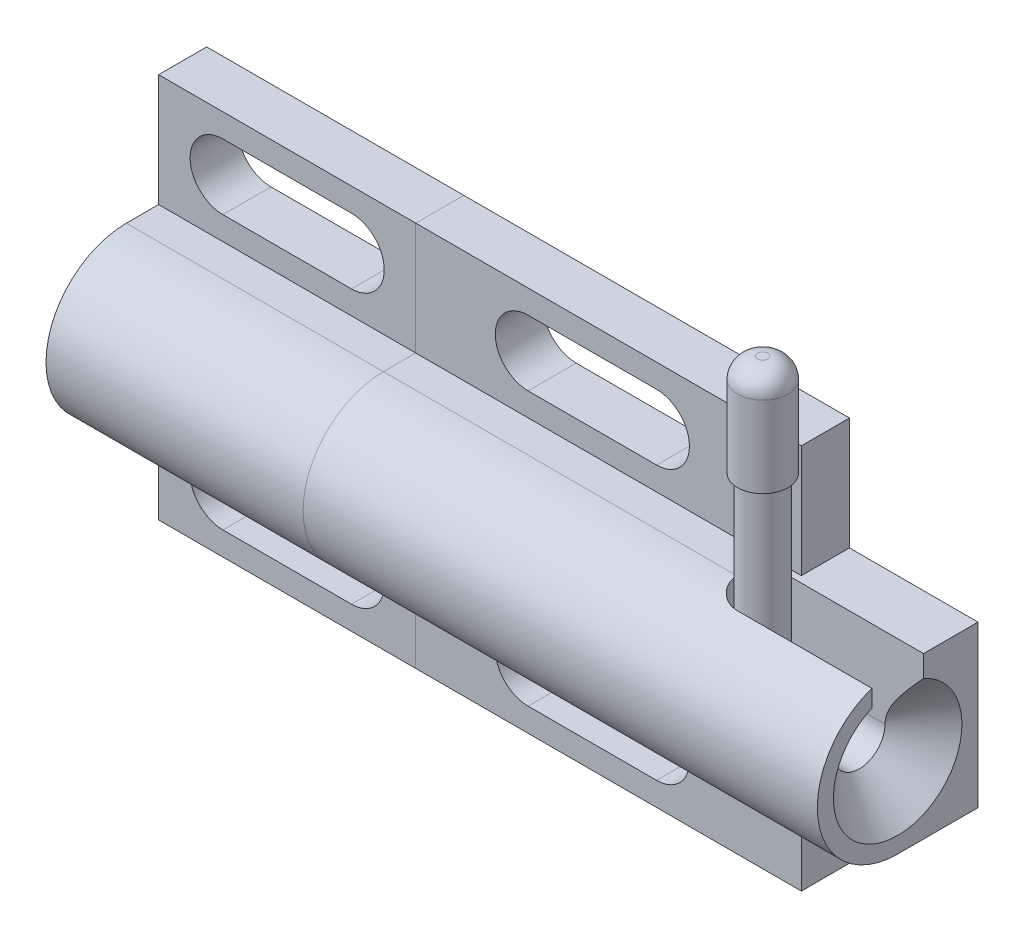
from build123d import *

# Parameters (mm, degrees)
BOSS_EXTRUDE1_DEPTH = 25.4
CUT_EXTRUDE2_REACH  = 37.498
BOSS_EXTRUDE2_DEPTH = 50.8
SKETCH5_W           = 4.7498
SKETCH5_H           = 11.1125
CUT_EXTRUDE3_DEPTH  = 12.7
CUT_EXTRUDE4_DEPTH  = 7.9375
CUT_EXTRUDE5_DEPTH  = 4.7498
SKETCH12_R          = 2


with BuildPart() as part:
    # Sketch1 → Boss-Extrude1 (new body)
    with BuildSketch(Plane(origin=(0, 0, 0), x_dir=(0, 0, -1), z_dir=(1, 0, 0))):
        with BuildLine():
            Line((0, -19.05), (0, 19.05))
            Line((0, 19.05), (-4.7498, 19.05))
            Line((-4.7498, 19.05), (-4.7498, 7.9375))
            Line((-4.7498, 7.9375), (-7.9375, 7.9375))
            ThreePointArc((-7.9375, 7.9375), (-15.875, 0), (-7.9375, -7.9375))
            Line((-7.9375, -7.9375), (-4.7498, -7.9375))
            Line((-4.7498, -7.9375), (-4.7498, -19.05))
            Line((-4.7498, -19.05), (0, -19.05))
        make_face()
    extrude(amount=-BOSS_EXTRUDE1_DEPTH)

    # Sketch2 → Cut-Revolve1 (revolve, cut)
    with BuildSketch(Plane(origin=(0, 0, 0), x_dir=(1, 0, 0), z_dir=(0, 1, 0)), mode=Mode.PRIVATE) as cut_revolve1_sk:
        Polygon((-25.4, -7.9375), (-25.4, -10.4902), (-19.05, -10.4902), (-19.05, -12.8397), (-1, -12.8397), (0, -13.8397), (0, -7.9375), align=None)
    revolve(cut_revolve1_sk.sketch.rotate(Axis((0, 0, 7.9375), (-1, 0, 0)), 180), axis=Axis((0, 0, 7.9375), (-1, 0, 0)), mode=Mode.SUBTRACT)

    # Sketch3 → Cut-Extrude2 (cut, up to next)
    with BuildSketch(Plane.XY, mode=Mode.PRIVATE) as cut_extrude2_sk1:
        with BuildLine():
            Line((-19.05, 16.7259), (-6.35, 16.7259))
            ThreePointArc((-6.35, 16.7259), (-3.1115, 13.4874), (-6.35, 10.2489))
            Line((-6.35, 10.2489), (-19.05, 10.2489))
            ThreePointArc((-19.05, 10.2489), (-22.2885, 13.4874), (-19.05, 16.7259))
        make_face()
    cut_extrude2_tool1 = extrude(cut_extrude2_sk1.sketch, amount=CUT_EXTRUDE2_REACH, mode=Mode.PRIVATE) & part.part
    # Sketch3 → Cut-Extrude2 (cut, up to next)
    with BuildSketch(Plane.XY, mode=Mode.PRIVATE) as cut_extrude2_sk2:
        with BuildLine():
            Line((-19.05, -16.7259), (-6.35, -16.7259))
            ThreePointArc((-6.35, -16.7259), (-3.1115, -13.4874), (-6.35, -10.2489))
            Line((-6.35, -10.2489), (-19.05, -10.2489))
            ThreePointArc((-19.05, -10.2489), (-22.2885, -13.4874), (-19.05, -16.7259))
        make_face()
    cut_extrude2_tool2 = extrude(cut_extrude2_sk2.sketch, amount=CUT_EXTRUDE2_REACH, mode=Mode.PRIVATE) & part.part
    add(cut_extrude2_tool1.solids().sort_by_distance((-12.7, 13.4874, 0))[0], mode=Mode.SUBTRACT)
    add(cut_extrude2_tool2.solids().sort_by_distance((-12.7, -13.4874, 0))[0], mode=Mode.SUBTRACT)


with BuildPart() as body_2:
    # Sketch4 → Boss-Extrude2 (new body)
    with BuildSketch(Plane(origin=(25.4, 0, 0), x_dir=(0, 0, -1), z_dir=(1, 0, 0))):
        with BuildLine():
            Line((0, -19.05), (0, 19.05))
            Line((0, 19.05), (-4.7498, 19.05))
            Line((-4.7498, 19.05), (-4.7498, 7.9375))
            Line((-4.7498, 7.9375), (-7.9375, 7.9375))
            ThreePointArc((-7.9375, 7.9375), (-15.875, 0), (-7.9375, -7.9375))
            Line((-7.9375, -7.9375), (-4.7498, -7.9375))
            Line((-4.7498, -7.9375), (-4.7498, -19.05))
            Line((-4.7498, -19.05), (0, -19.05))
        make_face()
    extrude(amount=BOSS_EXTRUDE2_DEPTH)

    # Sketch5 → Cut-Extrude3 (cut)
    with BuildSketch(Plane(origin=(76.2, 0, 0), x_dir=(0, 0, -1), z_dir=(1, 0, 0))):
        with Locations((-2.3749, 13.49375)):
            Rectangle(SKETCH5_W, SKETCH5_H)
        with Locations((-2.3749, -13.49375)):
            Rectangle(SKETCH5_W, SKETCH5_H)
    extrude(amount=-CUT_EXTRUDE3_DEPTH, mode=Mode.SUBTRACT)

    # Sketch6 → Cut-Revolve2 (revolve, cut)
    with BuildSketch(Plane(origin=(0, 0, 0), x_dir=(1, 0, 0), z_dir=(0, 1, 0))):
        Polygon((25.4, -7.9375), (25.4, -13.8397), (26.4, -12.8397), (57.15, -12.8397), (58.561722024, -10.4902), (72.4027, -10.4902), (76.2, -14.2875), (76.2, -7.9375), align=None)
    revolve(axis=Axis((25.4, 0, 7.9375), (1, 0, 0)), mode=Mode.SUBTRACT)

    # Sketch7 → Cut-Extrude4 (cut)
    with BuildSketch(Plane(origin=(0, 0, 0), x_dir=(1, 0, 0), z_dir=(0, 1, 0))):
        with BuildLine():
            Line((62.87516, -10.4902), (76.2, -10.4902))
            Line((76.2, -10.4902), (76.2, -5.3848))
            Line((76.2, -5.3848), (62.87516, -5.3848))
            ThreePointArc((62.87516, -5.3848), (60.32246, -7.9375), (62.87516, -10.4902))
        make_face()
    extrude(amount=CUT_EXTRUDE4_DEPTH, mode=Mode.SUBTRACT)

    # Sketch8 → Cut-Extrude5 (cut)
    with BuildSketch(Plane.XY):
        with BuildLine():
            Line((36.4998, 16.7259), (49.1998, 16.7259))
            ThreePointArc((49.1998, 16.7259), (52.4383, 13.4874), (49.1998, 10.2489))
            Line((49.1998, 10.2489), (36.4998, 10.2489))
            ThreePointArc((36.4998, 10.2489), (33.2613, 13.4874), (36.4998, 16.7259))
        make_face()
        with BuildLine():
            Line((36.4998, -16.7259), (49.1998, -16.7259))
            ThreePointArc((49.1998, -16.7259), (52.4383, -13.4874), (49.1998, -10.2489))
            Line((49.1998, -10.2489), (36.4998, -10.2489))
            ThreePointArc((36.4998, -10.2489), (33.2613, -13.4874), (36.4998, -16.7259))
        make_face()
    extrude(amount=CUT_EXTRUDE5_DEPTH, mode=Mode.SUBTRACT)


with BuildPart() as body_3:
    # Sketch9 → Revolve1 (revolve)
    with BuildSketch(Plane.XY.offset(7.9375), mode=Mode.PRIVATE) as revolve1_sk:
        Polygon((12.12516, 0), (12.12516, 4.2625), (12.62516, 4.7625), (41.62516, 4.7625), (41.62516, 2), (60.37516, 2), (60.37516, 0), align=None)
    revolve(revolve1_sk.sketch.rotate(Axis((12.12516, 0, 7.9375), (1, 0, 0)), 90), axis=Axis((12.12516, 0, 7.9375), (1, 0, 0)))



with BuildPart() as body_4:
    # Sketch11 → Revolve2 (revolve)
    with BuildSketch(Plane.XY.offset(7.9375), mode=Mode.PRIVATE) as revolve2_sk:
        with BuildLine():
            Line((60.87516, 2.5), (60.87516, 18))
            Line((60.87516, 18), (60.37516, 18))
            Line((60.37516, 18), (60.37516, 26))
            ThreePointArc((60.37516, 26), (60.960946438, 27.414213562), (62.37516, 28))
            Line((62.37516, 28), (62.87516, 28))
            Line((62.87516, 28), (62.87516, 2.5))
            Line((62.87516, 2.5), (60.87516, 2.5))
        make_face()
    revolve(revolve2_sk.sketch.rotate(Axis((62.87516, 2.5, 7.9375), (0, 1, 0)), 180), axis=Axis((62.87516, 2.5, 7.9375), (0, 1, 0)))


with BuildPart() as body_3_1:
    add(body_3.part)

    add(body_4.part)  # Sweep1 merges body 4
    # Sweep1: sweep along a path in Sketch13
    with BuildLine(Plane.XY.offset(7.9375)) as sweep1_path:
        ThreePointArc((60.37516, 0), (62.142926953, 0.732233047), (62.87516, 2.5))
    # Sketch12 → Sweep1 (sweep)
    with BuildSketch(Plane(origin=(60.37516, 0, 0), x_dir=(0, 0, -1), z_dir=(1, 0, 0))):
        with Locations((-7.9375, 0)):
            Circle(SKETCH12_R)
    sweep(path=sweep1_path.line)


with BuildPart() as part_1:
    # Body-Move/Copy1: read off the stored shape, not the designer's step
    # Body-Move/Copy1: moved
    add(part.part.moved(Location((25.4, 0, 0))))


solid = Compound([body_2.part, body_3_1.part, part_1.part])
